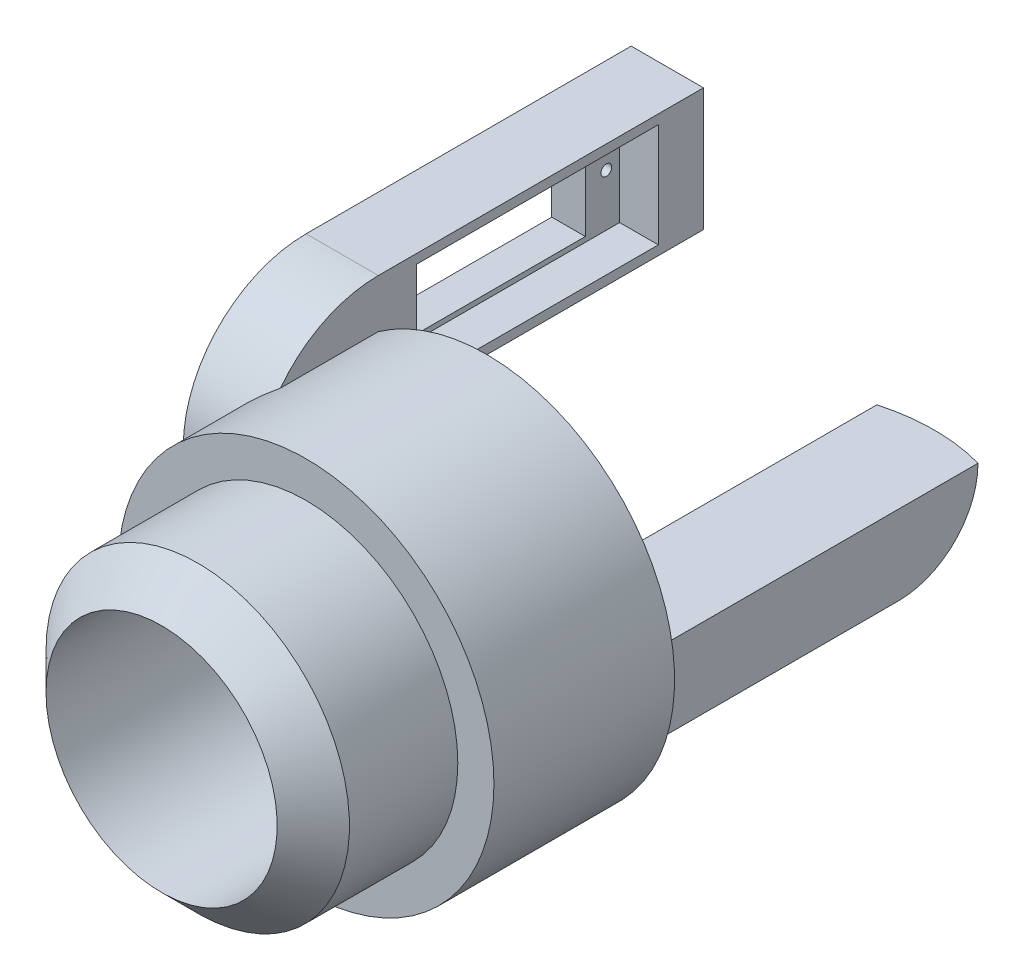
from build123d import *
from build123d.topology import SkipClean

# Parameters (mm, degrees)
SKETCH15_R          = 26
SKETCH15_R_2        = 21
BOSS_EXTRUDE2_DEPTH = 20
BOSS_EXTRUDE5_START = -10
SKETCH18_R          = 21
SKETCH18_R_2        = 16
BOSS_EXTRUDE5_DEPTH = 30
CHAMFER1_SIZE       = 5
BOSS_EXTRUDE6_START = 5
SKETCH21_R          = 26
SKETCH21_R_2        = 10
BOSS_EXTRUDE6_DEPTH = 5
BOSS_EXTRUDE8_START = 50
BOSS_EXTRUDE8_DEPTH = 50
REVOLVE2_ANGLE      = 90
BOSS_EXTRUDE9_START = -20
SKETCH26_W          = 45
SKETCH26_H          = 17
BOSS_EXTRUDE9_DEPTH = 5
CUT_EXTRUDE1_REACH  = 85.345
SKETCH27_W          = 24
SKETCH27_H          = 13
REVOLVE3_ANGLE      = 90
SKETCH29_W          = 1.422941242
SKETCH29_H          = 17
REVOLVE4_ANGLE      = 90
SKETCH31_R          = 0.75
CUT_EXTRUDE2_DEPTH  = 84.345121507
SKETCH32_W          = 33.5
SKETCH32_H          = 14.4
CUT_EXTRUDE3_DEPTH  = 5.35


with BuildPart() as part:
    # Sketch15 → Boss-Extrude2 (new body)
    with BuildSketch(Plane.XY):
        Circle(SKETCH15_R)
        Circle(SKETCH15_R_2, mode=Mode.SUBTRACT)
    extrude(amount=BOSS_EXTRUDE2_DEPTH)

    # Sketch18 → Boss-Extrude5 (add)
    with BuildSketch(Plane.XY.offset(20).offset(BOSS_EXTRUDE5_START)):
        Circle(SKETCH18_R)
        Circle(SKETCH18_R_2, mode=Mode.SUBTRACT)
    extrude(amount=BOSS_EXTRUDE5_DEPTH)

    # Chamfer1
    chamfer1_edges = [part.edges().sort_by_distance(p)[0] for p in [
        (-21, 0, 40),
    ]]
    chamfer(chamfer1_edges, length=CHAMFER1_SIZE - 0.0001)  # a hair under: the kernel refuses the full size

    # Sketch21 → Boss-Extrude6 (add)
    with BuildSketch(Plane(origin=(0, 0, 0), x_dir=(-1, 0, 0), z_dir=(0, 0, -1)).offset(BOSS_EXTRUDE6_START)):
        Circle(SKETCH21_R)
        Circle(SKETCH21_R_2, mode=Mode.SUBTRACT)
    extrude(amount=-BOSS_EXTRUDE6_DEPTH)

    # Sketch23 → Boss-Extrude8 (add)
    with BuildSketch(Plane(origin=(0, 0, -5), x_dir=(-1, 0, 0), z_dir=(0, 0, -1)).offset(BOSS_EXTRUDE8_START)):
        with BuildLine():
            Line((-7, -25.039968051), (-7, -14.039968051))
            Line((-7, -14.039968051), (7, -14.039968051))
            Line((7, -14.039968051), (7, -25.039968051))
            ThreePointArc((7, -25.039968051), (0, -26), (-7, -25.039968051))
        make_face()
    extrude(amount=-BOSS_EXTRUDE8_DEPTH)

    # Sketch25 → Revolve2 (revolve)
    with SkipClean():  # the faces are left unmerged after this step: merging them gives an invalid solid
        with BuildSketch(Plane(origin=(0, 0, -55), x_dir=(-1, 0, 0), z_dir=(0, 0, -1))):
            with BuildLine():
                Line((-7, -14.039968051), (-7, -25.039968051))
                ThreePointArc((-7, -25.039968051), (0, -26), (7, -25.039968051))
                Line((7, -25.039968051), (7, -14.039968051))
                Line((7, -14.039968051), (-7, -14.039968051))
            make_face()
        revolve(axis=Axis((-7, -14.039968051, -55), (1, 0, 0)), revolution_arc=REVOLVE2_ANGLE)

    # Sketch26 → Boss-Extrude9 (add, symmetric)
    with BuildSketch(Plane(origin=(0, 0, 0), x_dir=(0, 0, -1), z_dir=(1, 0, 0)).offset(BOSS_EXTRUDE9_START)):
        with Locations((27.5, 19.460031949)):
            Rectangle(SKETCH26_W, SKETCH26_H)
    extrude(amount=BOSS_EXTRUDE9_DEPTH, both=True)

    # Sketch27 → Cut-Extrude1 (cut, up to next)
    with BuildSketch(Plane(origin=(-15, 0, 0), x_dir=(0, 0, -1), z_dir=(1, 0, 0)), mode=Mode.PRIVATE) as cut_extrude1_sk1:
        with Locations((27, 19.460031949)):
            Rectangle(SKETCH27_W, SKETCH27_H)
    cut_extrude1_tool1 = extrude(cut_extrude1_sk1.sketch, amount=-CUT_EXTRUDE1_REACH, mode=Mode.PRIVATE) & part.part
    add(cut_extrude1_tool1.solids().sort_by_distance((-15, 19.460032, -27))[0], mode=Mode.SUBTRACT)

    # Sketch28 → Revolve3 (revolve)
    with SkipClean():  # the faces are left unmerged after this step: merging them gives an invalid solid
        with BuildSketch(Plane.XY.offset(-5)):
            with BuildLine():
                Line((-25, 10.960031949), (-23.577058758, 10.960031949))
                ThreePointArc((-23.577058758, 10.960031949), (-19.961216232, 16.659827326), (-15, 21.236760582))
                Line((-15, 21.236760582), (-15, 27.960031949))
                Line((-15, 27.960031949), (-25, 27.960031949))
                Line((-25, 27.960031949), (-25, 10.960031949))
            make_face()
        revolve(axis=Axis((-25, 10.960031949, -5), (1, 0, 0)), revolution_arc=REVOLVE3_ANGLE)

    # Sketch29 → Revolve4 (revolve)
    with SkipClean():  # the faces are left unmerged after this step: merging them gives an invalid solid
        with BuildSketch(Plane.XZ.offset(-10.960031949)):
            with Locations((-24.288529379, 3.5)):
                Rectangle(SKETCH29_W, SKETCH29_H)
        revolve(axis=Axis((-23.577058758, 10.960031949, 12), (0, 0, 1)), revolution_arc=REVOLVE4_ANGLE)

    # Sketch31 → Cut-Extrude2 (cut, through all)
    with SkipClean():  # the faces are left unmerged after this step: merging them gives an invalid solid
        with BuildSketch(Plane(origin=(-15, 0, 0), x_dir=(0, 0, -1), z_dir=(1, 0, 0))):
            with Locations((41.9, 19.460031949)):
                Circle(SKETCH31_R)
            with Locations((11.6, 19.460031949)):
                Circle(SKETCH31_R)
        extrude(amount=-CUT_EXTRUDE2_DEPTH, mode=Mode.SUBTRACT)

    # Sketch32 → Cut-Extrude3 (cut)
    with SkipClean():  # the faces are left unmerged after this step: merging them gives an invalid solid
        with BuildSketch(Plane(origin=(-15, 0, 0), x_dir=(0, 0, -1), z_dir=(1, 0, 0))):
            with Locations((27, 19.460031949)):
                Rectangle(SKETCH32_W, SKETCH32_H)
        extrude(amount=-CUT_EXTRUDE3_DEPTH, mode=Mode.SUBTRACT)


solid = part.part
